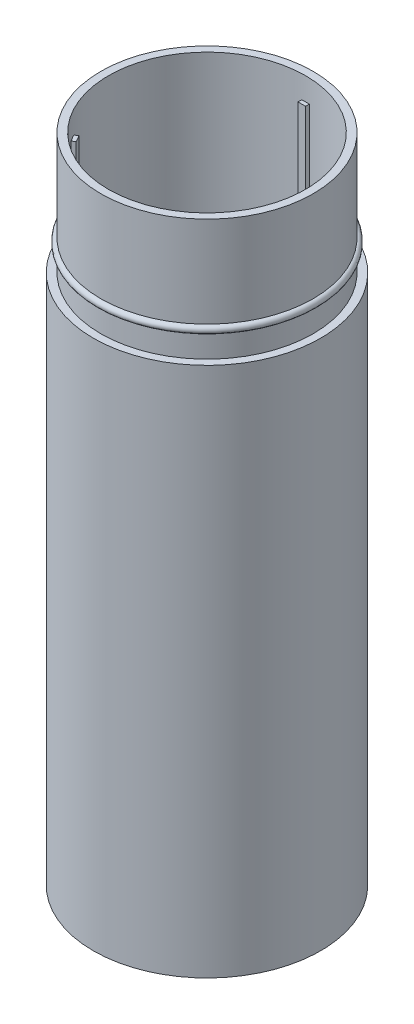
from build123d import *

# Parameters (mm, degrees)
SKETCH1_R           = 15
BOSS_EXTRUDE1_DEPTH = 70
SKETCH2_R           = 14
BOSS_EXTRUDE2_DEPTH = 16
SKETCH3_R           = 0.5
SKETCH4_R           = 13
CUT_EXTRUDE1_DEPTH  = 78
SKETCH5_R           = 2
CUT_EXTRUDE2_DEPTH  = 81.833161512
SKETCH6_W           = 1
SKETCH6_H           = 0.792029488
BOSS_EXTRUDE3_DEPTH = 75
CIRPATTERN1_COUNT   = 3
SKETCH7_R           = 14
CUT_EXTRUDE3_DEPTH  = 5
SCALE1_SCALE        = 0.655


with BuildPart() as part:
    # Sketch1 → Boss-Extrude1 (new body)
    with BuildSketch(Plane(origin=(0, 0, 0), x_dir=(1, 0, 0), z_dir=(0, 1, 0))):
        Circle(SKETCH1_R)
    extrude(amount=BOSS_EXTRUDE1_DEPTH)

    # Sketch2 → Boss-Extrude2 (add)
    with BuildSketch(Plane(origin=(0, 70, 0), x_dir=(1, 0, 0), z_dir=(0, 1, 0))):
        Circle(SKETCH2_R)
    extrude(amount=BOSS_EXTRUDE2_DEPTH)

    # Sketch3 → Revolve1 (revolve)
    with BuildSketch(Plane.XY):
        with Locations((-14, 73.5)):
            Circle(SKETCH3_R)
    revolve(axis=Axis((0, 70, 0), (0, 1, 0)))

    # Sketch4 → Cut-Extrude1 (cut)
    with BuildSketch(Plane(origin=(0, 86, 0), x_dir=(1, 0, 0), z_dir=(0, 1, 0))):
        Circle(SKETCH4_R)
    extrude(amount=-CUT_EXTRUDE1_DEPTH, mode=Mode.SUBTRACT)

    # Sketch5 → Cut-Extrude2 (cut, through all)
    with BuildSketch(Plane(origin=(0, 8, 0), x_dir=(1, 0, 0), z_dir=(0, 1, 0))):
        Circle(SKETCH5_R)
    extrude(amount=-CUT_EXTRUDE2_DEPTH, mode=Mode.SUBTRACT)

    # Sketch6 → Boss-Extrude3 (add)
    with BuildSketch(Plane(origin=(0, 8, 0), x_dir=(1, 0, 0), z_dir=(0, 1, 0))):
        with Locations((0, 12.896014744)):
            Rectangle(SKETCH6_W, SKETCH6_H)
    boss_extrude3 = extrude(amount=BOSS_EXTRUDE3_DEPTH)

    # CirPattern1: Boss-Extrude3 ×3 about axis
    cirpattern1_axis = Axis((0, 86, 0), (0, 1, 0))
    for i in range(1, CIRPATTERN1_COUNT):
        add(boss_extrude3.rotate(cirpattern1_axis, i * 360 / CIRPATTERN1_COUNT))

    # Sketch7 → Cut-Extrude3 (cut)
    with BuildSketch(Plane.XZ):
        Circle(SKETCH7_R)
    extrude(amount=-CUT_EXTRUDE3_DEPTH, mode=Mode.SUBTRACT)


with BuildPart() as part_1:
    # Scale1: scaled about (0, 0, 0)
    add(part.part.scale(SCALE1_SCALE))


solid = part_1.part
